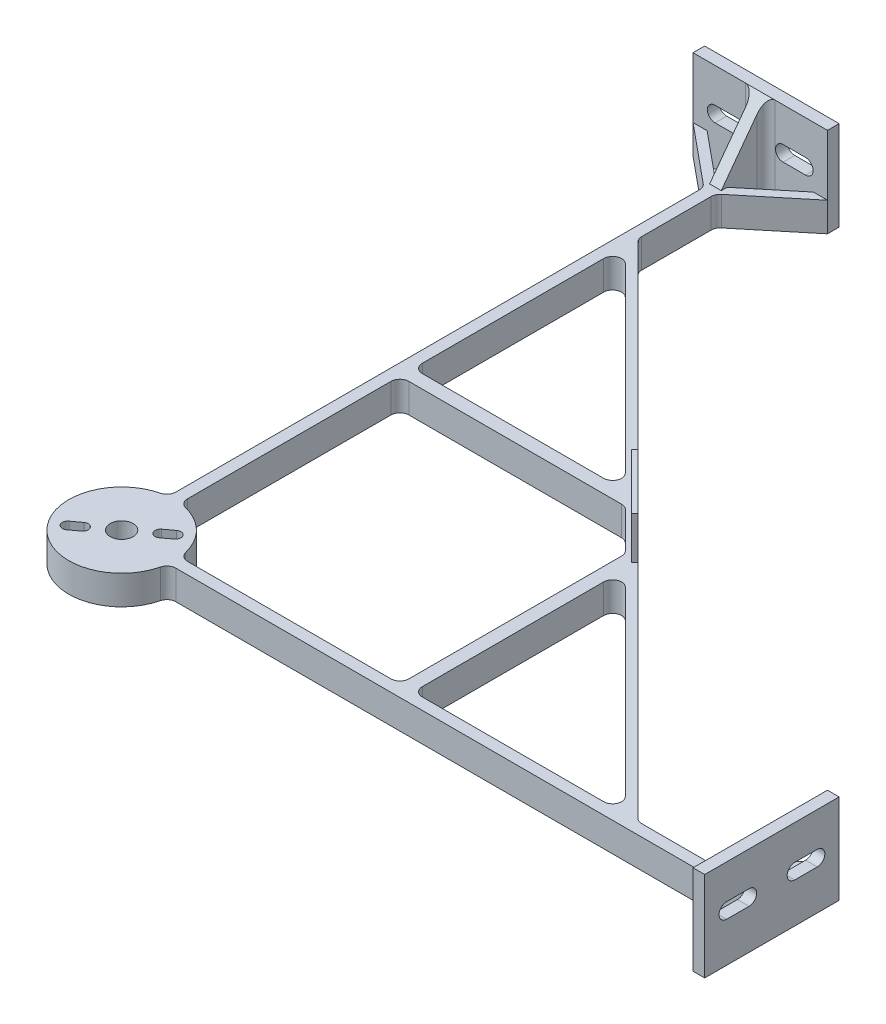
from build123d import *

# Parameters (mm, degrees)
SKETCH1_R           = 3.2385
BOSS_EXTRUDE1_DEPTH = 8.255
SKETCH3_W           = 3.302
SKETCH3_H           = 38.1
SKETCH3_W_2         = 38.1
SKETCH3_H_2         = 3.302
BOSS_EXTRUDE3_DEPTH = 25.4
BOSS_EXTRUDE4_DEPTH = 11.938
CUT_EXTRUDE1_DEPTH  = 276.581279586
SKETCH6_W           = 12.7
SKETCH6_H           = 3.302
BOSS_EXTRUDE5_DEPTH = 25.4
CUT_EXTRUDE2_DEPTH  = 25.4
SKETCH8_W           = 3.302
SKETCH8_H           = 12.7
BOSS_EXTRUDE6_DEPTH = 25.4
CUT_EXTRUDE3_DEPTH  = 25.4
FILLET1_R           = 2.54


with BuildPart() as part:
    # Sketch1 → Boss-Extrude1 (new body)
    with BuildSketch(Plane(origin=(0, 0, 0), x_dir=(1, 0, 0), z_dir=(0, 1, 0))):
        with BuildLine():
            Line((-1.651, 166.628963684), (-1.651, 14.89477744))
            ThreePointArc((-1.651, 14.89477744), (-10.596702223, -10.596702223), (14.89477744, -1.651))
            Line((14.89477744, -1.651), (166.628963684, -1.651))
            Line((166.628963684, -1.651), (180.975, -19.05))
            Line((180.975, -19.05), (180.975, -15.057345133))
            Line((180.975, -15.057345133), (169.921036316, -1.651))
            Line((169.921036316, -1.651), (180.975, -1.651))
            Line((180.975, -1.651), (180.975, 1.651))
            Line((180.975, 1.651), (169.921036316, 1.651))
            Line((169.921036316, 1.651), (180.975, 15.057345133))
            Line((180.975, 15.057345133), (180.975, 19.05))
            Line((180.975, 19.05), (166.628963684, 1.651))
            Line((166.628963684, 1.651), (144.671051224, 1.651))
            Line((144.671051224, 1.651), (1.651, 144.671051224))
            Line((1.651, 144.671051224), (1.651, 166.628963684))
            Line((1.651, 166.628963684), (19.05, 180.975))
            Line((19.05, 180.975), (15.057345133, 180.975))
            Line((15.057345133, 180.975), (1.651, 169.921036316))
            Line((1.651, 169.921036316), (1.651, 180.975))
            Line((1.651, 180.975), (-1.651, 180.975))
            Line((-1.651, 180.975), (-1.651, 169.921036316))
            Line((-1.651, 169.921036316), (-15.057345133, 180.975))
            Line((-15.057345133, 180.975), (-19.05, 180.975))
            Line((-19.05, 180.975), (-1.651, 166.628963684))
        make_face()
        with BuildLine():
            Line((-9.686234559, -5.271576621), (-7.236078848, -3.458556767))
            ThreePointArc((-7.236078848, -3.458556767), (-5.104491065, -3.777124696), (-5.423058993, -5.908712478))
            Line((-5.423058993, -5.908712478), (-7.873214705, -7.721732332))
            ThreePointArc((-7.873214705, -7.721732332), (-10.004802487, -7.403164404), (-9.686234559, -5.271576621))
        make_face(mode=Mode.SUBTRACT)
        Circle(SKETCH1_R, mode=Mode.SUBTRACT)
        with BuildLine():
            ThreePointArc((7.236078848, 3.458556767), (5.104491065, 3.777124696), (5.423058993, 5.908712478))
            Line((5.423058993, 5.908712478), (7.873214705, 7.721732332))
            ThreePointArc((7.873214705, 7.721732332), (10.004802487, 7.403164404), (9.686234559, 5.271576621))
            Line((9.686234559, 5.271576621), (7.236078848, 3.458556767))
        make_face(mode=Mode.SUBTRACT)
        with BuildLine():
            ThreePointArc((14.89477744, 1.651), (10.596702223, 10.596702223), (1.651, 14.89477744))
            Line((1.651, 14.89477744), (1.651, 77.202140867))
            Line((1.651, 77.202140867), (65.527807909, 77.202140867))
            Line((65.527807909, 77.202140867), (77.202140867, 65.527807909))
            Line((77.202140867, 65.527807909), (77.202140867, 1.651))
            Line((77.202140867, 1.651), (14.89477744, 1.651))
        make_face(mode=Mode.SUBTRACT)
        Polygon((141.078948776, 1.651), (81.012140867, 1.651), (81.012140867, 61.717807909), align=None, mode=Mode.SUBTRACT)
        Polygon((1.651, 81.012140867), (1.651, 141.078948776), (61.717807909, 81.012140867), align=None, mode=Mode.SUBTRACT)
    extrude(amount=BOSS_EXTRUDE1_DEPTH)

    # Sketch3 → Boss-Extrude3 (add)
    with BuildSketch(Plane(origin=(0, 0, 0), x_dir=(1, 0, 0), z_dir=(0, 1, 0))):
        with Locations((182.626, 0)):
            Rectangle(SKETCH3_W, SKETCH3_H)
        with Locations((0, 182.626)):
            Rectangle(SKETCH3_W_2, SKETCH3_H_2)
    extrude(amount=BOSS_EXTRUDE3_DEPTH)

    # Sketch4 → Boss-Extrude4 (add)
    with BuildSketch(Plane(origin=(0, 8.255, 0), x_dir=(1, 0, 0), z_dir=(0, 1, 0))):
        Polygon((65.258400226, 81.063650999), (64.360374613, 80.165625387), (80.165625387, 64.360374613), (81.063650999, 65.258400226), align=None)
    extrude(amount=BOSS_EXTRUDE4_DEPTH)

    # Sketch5 → Cut-Extrude1 (cut, through all)
    with BuildSketch(Plane(origin=(184.277, 0, 0), x_dir=(0, 0, -1), z_dir=(1, 0, 0))):
        with BuildLine():
            Line((-12.827, 15.63160537), (-6.477, 15.63160537))
            ThreePointArc((-6.477, 15.63160537), (-4.318, 13.47260537), (-6.477, 11.31360537))
            Line((-6.477, 11.31360537), (-12.827, 11.31360537))
            ThreePointArc((-12.827, 11.31360537), (-14.986, 13.47260537), (-12.827, 15.63160537))
        make_face()
        with BuildLine():
            Line((12.827, 15.63160537), (6.477, 15.63160537))
            ThreePointArc((6.477, 15.63160537), (4.318, 13.47260537), (6.477, 11.31360537))
            Line((6.477, 11.31360537), (12.827, 11.31360537))
            ThreePointArc((12.827, 11.31360537), (14.986, 13.47260537), (12.827, 15.63160537))
        make_face()
    cut_extrude1 = extrude(amount=-CUT_EXTRUDE1_DEPTH, mode=Mode.SUBTRACT)

    # Mirror1: Cut-Extrude1 across plane
    add(cut_extrude1.mirror(Plane(origin=(0, 0, 0), x_dir=(-0.7071067811865585, 0, 0.7071067811865367), z_dir=(0.7071067811865366, 0, 0.7071067811865585))), mode=Mode.SUBTRACT)

    # Sketch6 → Boss-Extrude5 (add)
    with BuildSketch(Plane(origin=(0, 0, 0), x_dir=(1, 0, 0), z_dir=(0, 1, 0))):
        with Locations((174.625, 0)):
            Rectangle(SKETCH6_W, SKETCH6_H)
    extrude(amount=BOSS_EXTRUDE5_DEPTH)

    # Sketch7 → Cut-Extrude2 (cut)
    with BuildSketch(Plane(origin=(0, 0, -1.651), x_dir=(-1, 0, 0), z_dir=(0, 0, -1))):
        Polygon((-180.975, 25.4), (-168.275, 8.255), (-168.275, 25.4), align=None)
    extrude(amount=-CUT_EXTRUDE2_DEPTH, mode=Mode.SUBTRACT)

    # Sketch8 → Boss-Extrude6 (add)
    with BuildSketch(Plane(origin=(0, 0, 0), x_dir=(1, 0, 0), z_dir=(0, 1, 0))):
        with Locations((0, 174.625)):
            Rectangle(SKETCH8_W, SKETCH8_H)
    extrude(amount=BOSS_EXTRUDE6_DEPTH)

    # Sketch9 → Cut-Extrude3 (cut)
    with BuildSketch(Plane(origin=(1.651, 0, 0), x_dir=(0, 0, -1), z_dir=(1, 0, 0))):
        Polygon((180.975, 25.4), (168.275, 8.255), (168.275, 25.4), align=None)
    extrude(amount=-CUT_EXTRUDE3_DEPTH, mode=Mode.SUBTRACT)

    # Fillet1
    fillet1_edges = [part.edges().sort_by_distance(p)[0] for p in [
        (180.975, 12.7, 1.651),
        (-1.651, 12.7, -180.975),
        (141.078948776, 4.1275, -1.651),
        (61.717807909, 4.1275, -81.012140867),
        (1.651, 4.1275, -141.078948776),
        (81.012140867, 4.1275, -61.717807909),
        (14.89477744, 4.1275, 1.651),
        (-1.651, 4.1275, -14.89477744),
        (180.975, 12.7, -1.651),
        (77.202140867, 4.1275, -1.651),
        (1.651, 12.7, -180.975),
        (1.651, 4.1275, -77.202140867),
        (166.628963684, 4.1275, 1.651),
        (65.527807909, 4.1275, -77.202140867),
        (-1.651, 4.1275, -166.628963684),
        (77.202140867, 4.1275, -65.527807909),
        (1.651, 4.1275, -166.628963684),
        (1.651, 4.1275, -14.89477744),
        (1.651, 4.1275, -144.671051224),
        (1.651, 4.1275, -81.012140867),
        (81.012140867, 4.1275, -1.651),
        (166.628963684, 4.1275, -1.651),
        (14.89477744, 4.1275, -1.651),
        (144.671051224, 4.1275, -1.651),
    ]]
    fillet(fillet1_edges, radius=FILLET1_R)


solid = part.part
